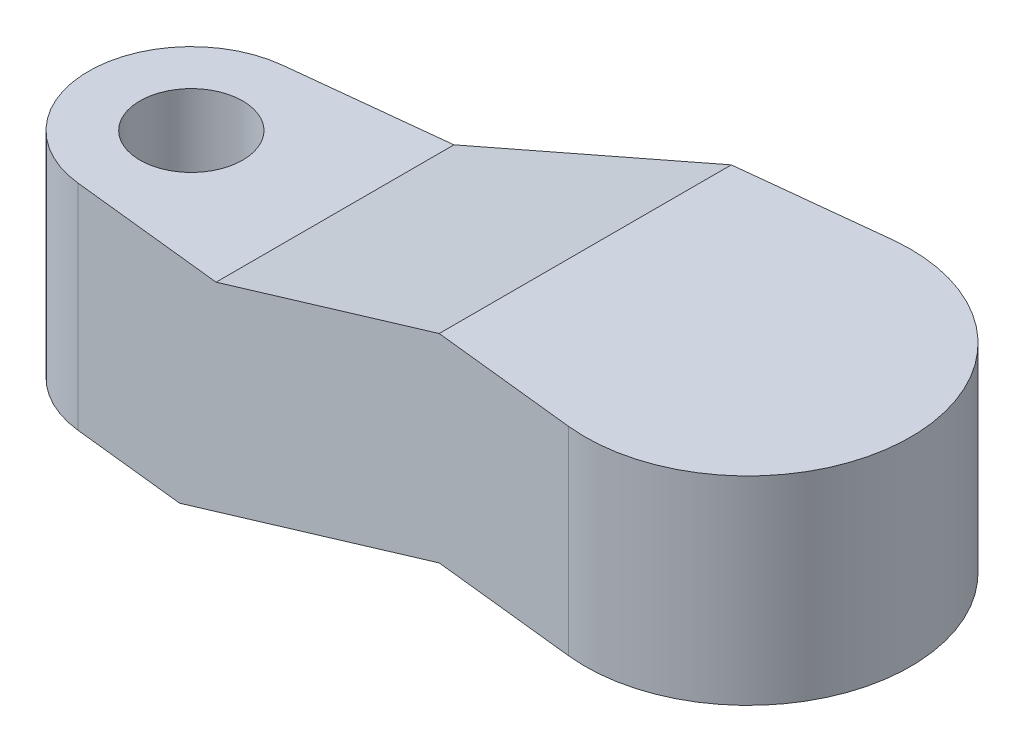
from build123d import *

# Parameters (mm, degrees)
BOSS_EXTRUDE1_DEPTH     = 9
CUT_EXTRUDE1_DEPTH      = 22.774411588
CUT_EXTRUDE1_DEPTH_BACK = 22.774411588
SKETCH3_R               = 2
CUT_EXTRUDE2_DEPTH      = 2
SKETCH4_R               = 1.5
CUT_EXTRUDE3_DEPTH      = 22.774411588


with BuildPart() as part:
    # Sketch1 → Boss-Extrude1 (new body)
    with BuildSketch(Plane(origin=(0, 0, 0), x_dir=(1, 0, 0), z_dir=(0, 1, 0))):
        with BuildLine():
            Line((-16.573076923, 2.982552816), (-0.511538462, 4.722375292))
            ThreePointArc((-0.511538462, 4.722375292), (4.75, 0), (-0.511538462, -4.722375292))
            Line((-0.511538462, -4.722375292), (-16.573076923, -2.982552816))
            ThreePointArc((-16.573076923, -2.982552816), (-19.25, 0), (-16.573076923, 2.982552816))
        make_face()
    extrude(amount=BOSS_EXTRUDE1_DEPTH)

    # Sketch2 → Cut-Extrude1 (cut, two sides: drawn at the far end of the back side and taken through both)
    with BuildSketch(Plane.XY.offset(-CUT_EXTRUDE1_DEPTH_BACK)):
        Polygon((-4.75, 9), (-12.0546875, 6.25), (-19.25, 6.25), (-19.25, 9), align=None)
        Polygon((-13.25, 0), (-4.75, 3.2), (4.75, 3.2), (4.75, 0), align=None)
    extrude(amount=CUT_EXTRUDE1_DEPTH + CUT_EXTRUDE1_DEPTH_BACK, mode=Mode.SUBTRACT)

    # Sketch3 → Cut-Extrude2 (cut)
    with BuildSketch(Plane.XZ.offset(-3.2)):
        Circle(SKETCH3_R)
    extrude(amount=-CUT_EXTRUDE2_DEPTH, mode=Mode.SUBTRACT)

    # Sketch4 → Cut-Extrude3 (cut, through all)
    with BuildSketch(Plane.XZ):
        with Locations((-16.25, 0)):
            Circle(SKETCH4_R)
    extrude(amount=-CUT_EXTRUDE3_DEPTH, mode=Mode.SUBTRACT)


solid = part.part
